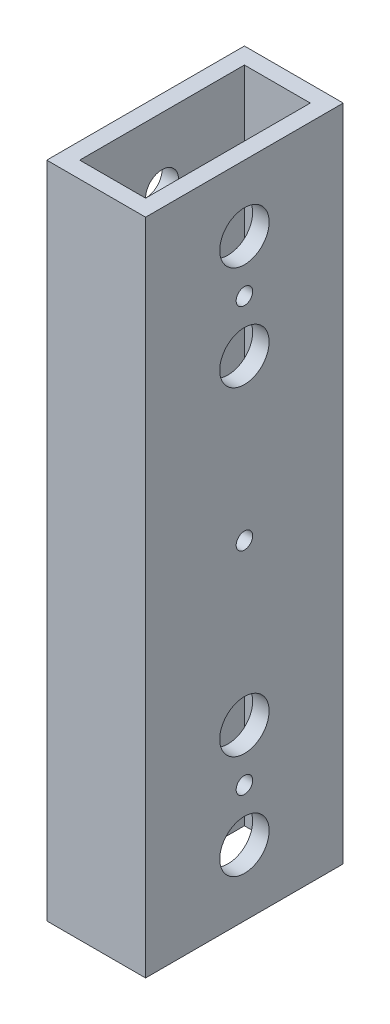
from build123d import *

# Parameters (mm, degrees)
SKETCH1_W           = 19.05
SKETCH1_H           = 38.1
SKETCH1_W_2         = 12.7
SKETCH1_H_2         = 31.75
BOSS_EXTRUDE1_DEPTH = 127
SKETCH2_R           = 3.175
CUT_EXTRUDE1_DEPTH  = 134.953396747
CUT_EXTRUDE2_REACH  = 135.953
SKETCH3_R           = 4.7625
SKETCH4_R           = 1.5875
UCHAN_MOUNT_DEPTH   = 134.953396747
CUT_EXTRUDE4_REACH  = 135.953
SKETCH5_R           = 4.7625


with BuildPart() as part:
    # Sketch1 → Boss-Extrude1 (new body)
    with BuildSketch(Plane(origin=(0, 0, 0), x_dir=(1, 0, 0), z_dir=(0, 1, 0))):
        with Locations((9.525, 19.05)):
            Rectangle(SKETCH1_W, SKETCH1_H)
        with Locations((9.525, 19.05)):
            Rectangle(SKETCH1_W_2, SKETCH1_H_2, mode=Mode.SUBTRACT)
    extrude(amount=BOSS_EXTRUDE1_DEPTH)

    # Sketch2 → Cut-Extrude1 (cut, through all)
    with BuildSketch(Plane(origin=(19.05, 0, 0), x_dir=(0, 0, -1), z_dir=(1, 0, 0))):
        with Locations((19.05, 12.7)):
            Circle(SKETCH2_R)
        with Locations((19.05, 32.69996)):
            Circle(SKETCH2_R)
        with Locations((19.05, 94.30004)):
            Circle(SKETCH2_R)
        with Locations((19.05, 114.3)):
            Circle(SKETCH2_R)
    extrude(amount=-CUT_EXTRUDE1_DEPTH, mode=Mode.SUBTRACT)

    # Sketch3 → Cut-Extrude2 (cut, up to next)
    with BuildSketch(Plane(origin=(19.05, 0, 0), x_dir=(0, 0, -1), z_dir=(1, 0, 0)), mode=Mode.PRIVATE) as cut_extrude2_sk1:
        with Locations((19.05, 114.3)):
            Circle(SKETCH3_R)
    cut_extrude2_tool1 = extrude(cut_extrude2_sk1.sketch, amount=-CUT_EXTRUDE2_REACH, mode=Mode.PRIVATE) & part.part
    # Sketch3 → Cut-Extrude2 (cut, up to next)
    with BuildSketch(Plane(origin=(19.05, 0, 0), x_dir=(0, 0, -1), z_dir=(1, 0, 0)), mode=Mode.PRIVATE) as cut_extrude2_sk2:
        with Locations((19.05, 94.30004)):
            Circle(SKETCH3_R)
    cut_extrude2_tool2 = extrude(cut_extrude2_sk2.sketch, amount=-CUT_EXTRUDE2_REACH, mode=Mode.PRIVATE) & part.part
    # Sketch3 → Cut-Extrude2 (cut, up to next)
    with BuildSketch(Plane(origin=(19.05, 0, 0), x_dir=(0, 0, -1), z_dir=(1, 0, 0)), mode=Mode.PRIVATE) as cut_extrude2_sk3:
        with Locations((19.05, 32.69996)):
            Circle(SKETCH3_R)
    cut_extrude2_tool3 = extrude(cut_extrude2_sk3.sketch, amount=-CUT_EXTRUDE2_REACH, mode=Mode.PRIVATE) & part.part
    # Sketch3 → Cut-Extrude2 (cut, up to next)
    with BuildSketch(Plane(origin=(19.05, 0, 0), x_dir=(0, 0, -1), z_dir=(1, 0, 0)), mode=Mode.PRIVATE) as cut_extrude2_sk4:
        with Locations((19.05, 12.7)):
            Circle(SKETCH3_R)
    cut_extrude2_tool4 = extrude(cut_extrude2_sk4.sketch, amount=-CUT_EXTRUDE2_REACH, mode=Mode.PRIVATE) & part.part
    add(cut_extrude2_tool1.solids().sort_by_distance((19.05, 114.3, -19.05))[0], mode=Mode.SUBTRACT)
    add(cut_extrude2_tool2.solids().sort_by_distance((19.05, 94.30004, -19.05))[0], mode=Mode.SUBTRACT)
    add(cut_extrude2_tool3.solids().sort_by_distance((19.05, 32.69996, -19.05))[0], mode=Mode.SUBTRACT)
    add(cut_extrude2_tool4.solids().sort_by_distance((19.05, 12.7, -19.05))[0], mode=Mode.SUBTRACT)

    # Sketch4 → UChan_Mount (cut, through all)
    with BuildSketch(Plane(origin=(19.05, 0, 0), x_dir=(0, 0, -1), z_dir=(1, 0, 0))):
        with Locations((19.05, 22.69998)):
            Circle(SKETCH4_R)
        with Locations((19.05, 63.5)):
            Circle(SKETCH4_R)
        with Locations((19.05, 104.30002)):
            Circle(SKETCH4_R)
    extrude(amount=-UCHAN_MOUNT_DEPTH, mode=Mode.SUBTRACT)

    # Sketch5 → Cut-Extrude4 (cut, up to next)
    with BuildSketch(Plane.ZY, mode=Mode.PRIVATE) as cut_extrude4_sk1:
        with Locations((-19.05, 104.30002)):
            Circle(SKETCH5_R)
    cut_extrude4_tool1 = extrude(cut_extrude4_sk1.sketch, amount=-CUT_EXTRUDE4_REACH, mode=Mode.PRIVATE) & part.part
    # Sketch5 → Cut-Extrude4 (cut, up to next)
    with BuildSketch(Plane.ZY, mode=Mode.PRIVATE) as cut_extrude4_sk2:
        with Locations((-19.05, 63.5)):
            Circle(SKETCH5_R)
    cut_extrude4_tool2 = extrude(cut_extrude4_sk2.sketch, amount=-CUT_EXTRUDE4_REACH, mode=Mode.PRIVATE) & part.part
    # Sketch5 → Cut-Extrude4 (cut, up to next)
    with BuildSketch(Plane.ZY, mode=Mode.PRIVATE) as cut_extrude4_sk3:
        with Locations((-19.05, 22.69998)):
            Circle(SKETCH5_R)
    cut_extrude4_tool3 = extrude(cut_extrude4_sk3.sketch, amount=-CUT_EXTRUDE4_REACH, mode=Mode.PRIVATE) & part.part
    add(cut_extrude4_tool1.solids().sort_by_distance((0, 104.30002, -19.05))[0], mode=Mode.SUBTRACT)
    add(cut_extrude4_tool2.solids().sort_by_distance((0, 63.5, -19.05))[0], mode=Mode.SUBTRACT)
    add(cut_extrude4_tool3.solids().sort_by_distance((0, 22.69998, -19.05))[0], mode=Mode.SUBTRACT)


solid = part.part
